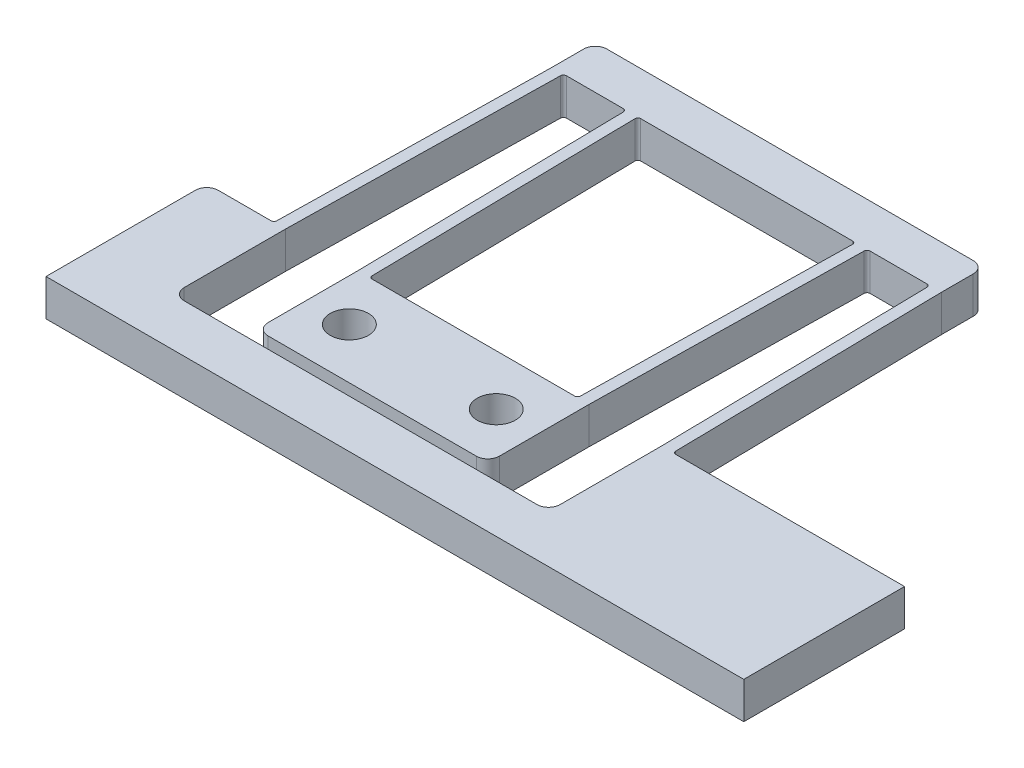
from build123d import *

# Parameters (mm, degrees)
CORNER_EXTRUDE_DEPTH    = 3.175
FLEXTURE_BEAM_FILLETS_R = 0.5
OUTER_FILLETS_R         = 2
M6_CLEARANCE_HOLE1_D    = 6.6


with BuildPart() as part:
    # ADJUST THIS Flexture-Corner → Corner-Extrude (new, symmetric)
    with BuildSketch(Plane(origin=(0, 0, 0), x_dir=(1, 0, 0), z_dir=(0, 1, 0))):
        Polygon((-40.873447162, 75.05), (-40.873447162, 82.55), (-108.224552838, 82.55), (-108.224552838, 75.05), (-109.049304656, 27.8), (-120.65, 27.8), (-120.65, 0), (0, 0), (0, 27.8), (-40.048695344, 27.8), align=None)
        Polygon((-53.724248182, 75.05), (-42.873751818, 75.05), (-42.049, 27.8), (-42.049, 8.3), (-107.049, 8.3), (-107.049, 27.8), (-106.224248182, 75.05), (-95.373751818, 75.05), (-94.549, 27.8), (-94.549, 10.3), (-54.549, 10.3), (-54.549, 27.8), align=None, mode=Mode.SUBTRACT)
        Polygon((-93.373447162, 75.05), (-55.724552838, 75.05), (-56.549304656, 27.8), (-92.548695344, 27.8), align=None, mode=Mode.SUBTRACT)
    extrude(amount=CORNER_EXTRUDE_DEPTH, both=True)

    # Flexture-Beam-Fillets
    flexture_beam_fillets_edges = [part.edges().sort_by_distance(p)[0] for p in [
        (-56.549304656, 0, -27.8),
        (-109.049304656, 0, -27.8),
        (-92.548695344, 0, -27.8),
        (-54.549, 0, -27.8),
        (-40.048695344, 0, -27.8),
        (-42.873751818, 0, -75.05),
        (-55.724552838, 0, -75.05),
        (-108.224552838, 0, -75.05),
        (-40.873447162, 0, -75.05),
        (-53.724248182, 0, -75.05),
        (-93.373447162, 0, -75.05),
        (-95.373751818, 0, -75.05),
        (-106.224248182, 0, -75.05),
        (-94.549, 0, -27.8),
        (-42.049, 0, -27.8),
        (-107.049, 0, -27.8),
    ]]
    fillet(flexture_beam_fillets_edges, radius=FLEXTURE_BEAM_FILLETS_R)

    # Outer-Fillets
    outer_fillets_edges = [part.edges().sort_by_distance(p)[0] for p in [
        (-54.549, 0, -10.3),
        (-40.873447162, 0, -82.55),
        (-42.049, 0, -8.3),
        (-94.549, 0, -10.3),
        (-107.049, 0, -8.3),
        (-108.224552838, 0, -82.55),
        (-120.65, 0, -27.8),
    ]]
    fillet(outer_fillets_edges, radius=OUTER_FILLETS_R)

    # M6 Clearance Hole1 (through all)
    with Locations(Plane(origin=(0, 3.175, 0), x_dir=(1, 0, 0), z_dir=(0, 1, 0))):
        with Locations((-87.249, -19.05), (-61.849, -19.05), (-61.849, 19.05), (-87.249, 19.05), (61.849, 19.05), (87.249, 19.05), (61.849, -19.05), (87.249, -19.05)):
            Hole(M6_CLEARANCE_HOLE1_D / 2)


solid = part.part
